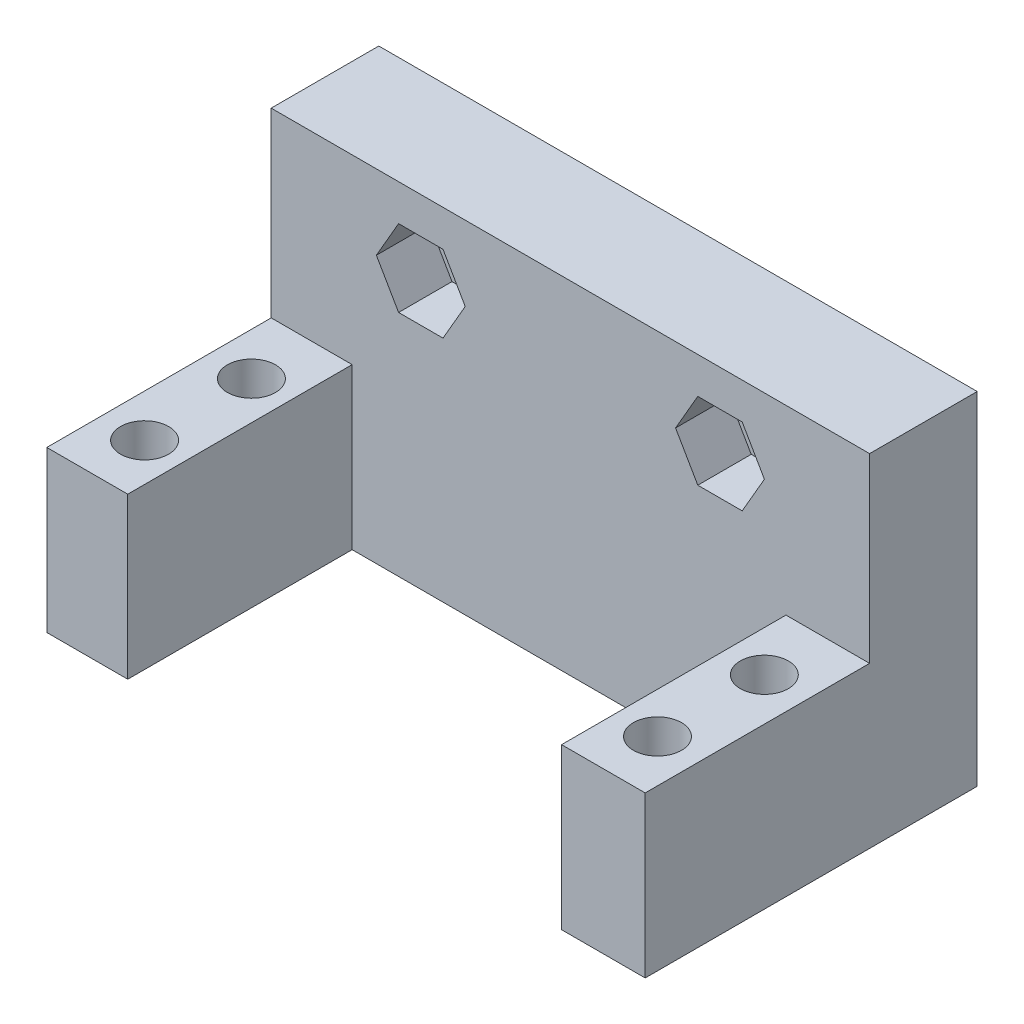
from build123d import *

# Parameters (mm, degrees)
SZKIC1_W                       = 40
SZKIC1_H                       = 14
SZKIC1_R                       = 2
DODANIE_WYCI_GNI_CIE1_DEPTH    = 10.77
SZKIC2_W                       = 56
SZKIC2_H                       = 14
DODANIE_WYCI_GNI_CIE2_DEPTH    = 20.3
SZKIC5_R                       = 2.25
WYTNIJ_WYCI_GNI_CIE2_DEPTH     = 14
SZKIC8_W                       = 56
SZKIC8_H                       = 10.77
DODANIE_WYCI_GNI_CIE3_DEPTH    = 14
WYTNIJ_WYCI_GNI_CIE3_START     = -14
WYTNIJ_WYCI_GNI_CIE3_OUTLINE_W = 42
WYTNIJ_WYCI_GNI_CIE3_OUTLINE_H = 21
WYTNIJ_WYCI_GNI_CIE3_DEPTH     = 14
SZKIC12_R                      = 2.25
DODANIE_WYCI_GNI_CIE4_DEPTH    = 18
WYTNIJ_WYCI_GNI_CIE1_DEPTH     = 5
SZKIC9_R                       = 2.2
WYTNIJ_WYCI_GNI_CIE4_DEPTH     = 21
SZKIC10_W                      = 56
SZKIC10_H                      = 21
WYTNIJ_WYCI_GNI_CIE5_DEPTH     = 17
SZKIC13_W                      = 21
SZKIC13_H                      = 15
DODANIE_WYCI_GNI_CIE5_DEPTH    = 0.7
SZKIC16_W                      = 21
SZKIC16_H                      = 15
DODANIE_WYCI_GNI_CIE7_DEPTH    = 0.7


# Read off the part's stored shape, not the designer's step: Wytnij-wyciągnięcie3
with BuildPart() as part:
    # Szkic1 → Dodanie-wyciągnięcie1 (new body)
    with BuildSketch(Plane.XY):
        Rectangle(SZKIC1_W, SZKIC1_H)
        with Locations((-14, 0)):
            Circle(SZKIC1_R, mode=Mode.SUBTRACT)
        with Locations((14, 0)):
            Circle(SZKIC1_R, mode=Mode.SUBTRACT)
    extrude(amount=DODANIE_WYCI_GNI_CIE1_DEPTH)

    # Szkic2 → Dodanie-wyciągnięcie2 (add)
    with BuildSketch(Plane.XY.offset(10.77)):
        Rectangle(SZKIC2_W, SZKIC2_H)
    extrude(amount=DODANIE_WYCI_GNI_CIE2_DEPTH)

    # Szkic5 → Wytnij-wyciągnięcie2 (cut)
    with BuildSketch(Plane(origin=(0, 7, 0), x_dir=(1, 0, 0), z_dir=(0, 1, 0))):
        with Locations(Location((-24, -15.92, 0), (0, 0, 180))):
            Circle(SZKIC5_R)
        with Locations(Location((24, -15.92, 0), (0, 0, 180))):
            Circle(SZKIC5_R)
        with Locations(Location((24, -25.92, 0), (0, 0, 180))):
            Circle(SZKIC5_R)
        with Locations(Location((-24, -25.92, 0), (0, 0, 180))):
            Circle(SZKIC5_R)
    extrude(amount=-WYTNIJ_WYCI_GNI_CIE2_DEPTH, mode=Mode.SUBTRACT)

    # Szkic8 → Dodanie-wyciągnięcie3 (add)
    with BuildSketch(Plane(origin=(0, 7, 0), x_dir=(1, 0, 0), z_dir=(0, 1, 0))):
        with Locations((0, -5.385)):
            Rectangle(SZKIC8_W, SZKIC8_H)
    extrude(amount=-DODANIE_WYCI_GNI_CIE3_DEPTH)

    # Wytnij-wyciągnięcie3 outline → Wytnij-wyciągnięcie3 (cut)
    with BuildSketch(Plane(origin=(0, 7, 0), x_dir=(1, 0, 0), z_dir=(0, 1, 0)).offset(WYTNIJ_WYCI_GNI_CIE3_START)):
        with Locations((-0.124911353, -20.57)):
            Rectangle(WYTNIJ_WYCI_GNI_CIE3_OUTLINE_W, WYTNIJ_WYCI_GNI_CIE3_OUTLINE_H)
    extrude(amount=WYTNIJ_WYCI_GNI_CIE3_DEPTH, mode=Mode.SUBTRACT)

    # Szkic12 → Dodanie-wyciągnięcie4 (add)
    with BuildSketch(Plane.XZ.offset(7)):
        Polygon((20.875088647, 31.07), (20.875088647, 10.07), (-21.124911353, 10.07), (-21.124911353, 31.07), (-28, 31.07), (-28, 0), (28, 0), (28, 31.07), align=None)
        with Locations(Location((-24, 25.92, 0), (0, 0, 180))):
            Circle(SZKIC12_R, mode=Mode.SUBTRACT)
        with Locations(Location((24, 25.92, 0), (0, 0, 180))):
            Circle(SZKIC12_R, mode=Mode.SUBTRACT)
        with Locations(Location((-24, 15.92, 0), (0, 0, 180))):
            Circle(SZKIC12_R, mode=Mode.SUBTRACT)
        with Locations(Location((24, 15.92, 0), (0, 0, 180))):
            Circle(SZKIC12_R, mode=Mode.SUBTRACT)
    extrude(amount=DODANIE_WYCI_GNI_CIE4_DEPTH)

    # Szkic4 → Wytnij-wyciągnięcie1 (cut)
    with BuildSketch(Plane.XY.offset(10.07)):
        Polygon((-16.078460969, 3.6), (-18.156921938, 0), (-16.078460969, -3.6), (-11.921539031, -3.6), (-9.843078062, 0), (-11.921539031, 3.6), align=None)
        Polygon((11.921539031, 3.6), (9.843078062, 0), (11.921539031, -3.6), (16.078460969, -3.6), (18.156921938, 0), (16.078460969, 3.6), align=None)
    extrude(amount=-WYTNIJ_WYCI_GNI_CIE1_DEPTH, mode=Mode.SUBTRACT)

    # Szkic9 → Wytnij-wyciągnięcie4 (cut)
    with BuildSketch(Plane.XY.offset(10.07)):
        with Locations((-14, 0)):
            Circle(SZKIC9_R)
        with Locations((14, 0)):
            Circle(SZKIC9_R)
    extrude(amount=-WYTNIJ_WYCI_GNI_CIE4_DEPTH, mode=Mode.SUBTRACT)

    # Szkic10 → Wytnij-wyciągnięcie5 (cut)
    with BuildSketch(Plane(origin=(0, 7, 0), x_dir=(1, 0, 0), z_dir=(0, 1, 0))):
        with Locations((0, -20.57)):
            Rectangle(SZKIC10_W, SZKIC10_H)
    extrude(amount=-WYTNIJ_WYCI_GNI_CIE5_DEPTH, mode=Mode.SUBTRACT)

    # Szkic13 → Dodanie-wyciągnięcie5 (add)
    with BuildSketch(Plane(origin=(-21.124911353, 0, 0), x_dir=(0, 0, -1), z_dir=(1, 0, 0))):
        with Locations((-20.57, -17.5)):
            Rectangle(SZKIC13_W, SZKIC13_H)
    extrude(amount=DODANIE_WYCI_GNI_CIE5_DEPTH)

    # Szkic16 → Dodanie-wyciągnięcie7 (add)
    with BuildSketch(Plane.ZY.offset(-20.875088647)):
        with Locations((20.57, -17.5)):
            Rectangle(SZKIC16_W, SZKIC16_H)
    extrude(amount=DODANIE_WYCI_GNI_CIE7_DEPTH)


solid = part.part
